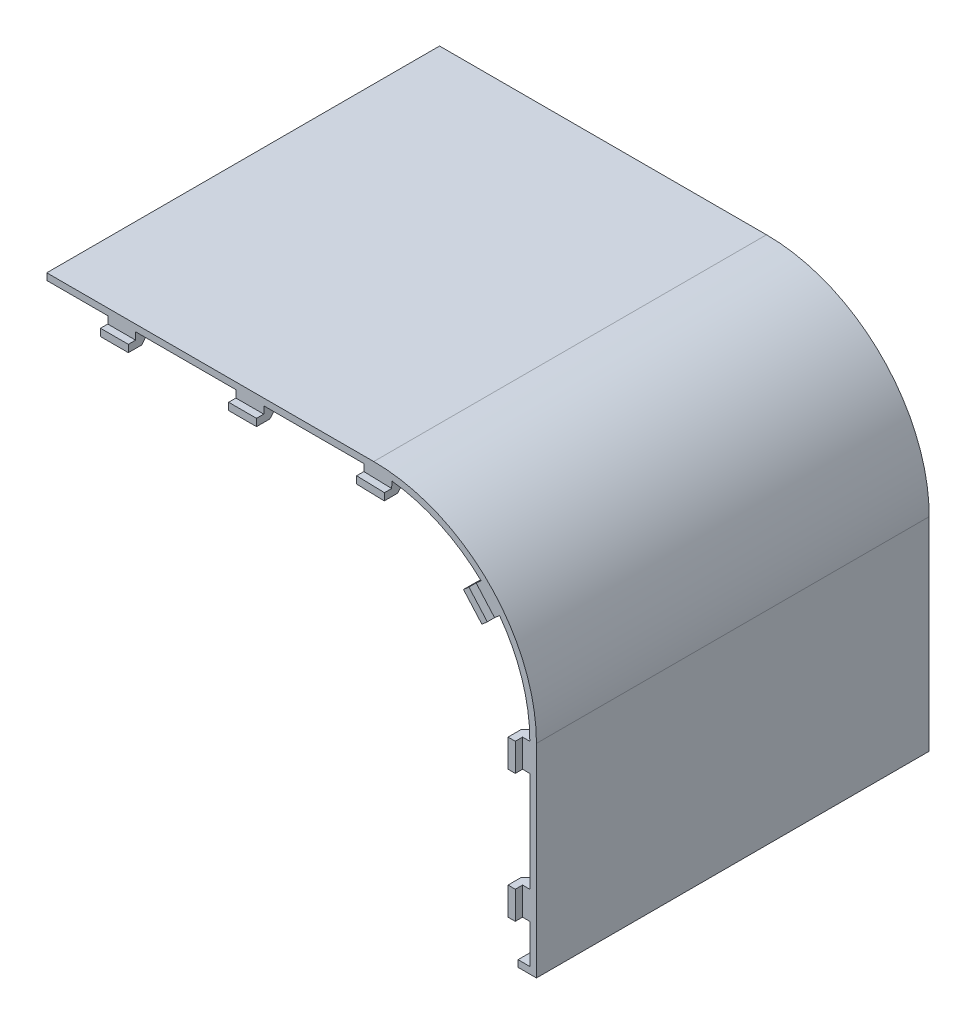
from build123d import *

# Parameters (mm, degrees)
EXTRUDE_START           = 0.1
EXTRUDE_1_DEPTH         = 70.5
SKETCH_2_W              = 5.622893455
SKETCH_2_H              = 15.568085914
CUT_EXTRUDE_1_DEPTH     = 3.9
EXTRUDE_START_2         = 7
EXTRUDE_2_DEPTH         = 5
PATTERN_START           = 11.046937644
PATTERN_CURVE_4_DEPTH   = 5
PATTERN_START_2         = 34.046937644
PATTERN_CURVE_4_2_DEPTH = 5
PATTERN_START_3         = 55.811216895
PATTERN_CURVE_4_3_DEPTH = 5
PATTERN_START_4         = 23.901307005
PATTERN_CURVE_4_4_DEPTH = 5
PATTERN_START_5         = 11.347780174
PATTERN_CURVE_4_5_DEPTH = 5


# Read off the part's stored shape, not the designer's step: Кривая4
with BuildPart() as part:
    # Эскиз1 → Бобышка-Вытянуть1 (new body)
    with BuildSketch(Plane.XY.offset(EXTRUDE_START)):
        with BuildLine():
            Line((87.992424037, 16.615738698), (87.992424037, -19.852219826))
            Line((87.992424037, -19.852219826), (86.792424037, -19.852219826))
            Line((86.792424037, -19.852219826), (84.692424037, -19.852219826))
            Line((84.692424037, -19.852219826), (84.692424037, -18.652219826))
            Line((84.692424037, -18.652219826), (86.792424037, -18.652219826))
            Line((86.792424037, -18.652219826), (86.792424037, 16.615738698))
            ThreePointArc((86.792424037, 16.615738698), (78.589229033, 36.420003331), (58.7849644, 44.623198335))
            Line((58.7849644, 44.623198335), (0.1, 44.623198335))
            Line((0.1, 44.623198335), (0.1, 45.823198335))
            Line((0.1, 45.823198335), (58.7849644, 45.823198335))
            ThreePointArc((58.7849644, 45.823198335), (79.43775717, 37.268531468), (87.992424037, 16.615738698))
        make_face()
    extrude(amount=EXTRUDE_1_DEPTH)

    # Эскиз2 → Вырез-Вытянуть1 (cut)
    with BuildSketch(Plane(origin=(0, -18.652219826, 0), x_dir=(1, 0, 0), z_dir=(0, 1, 0))):
        with Locations((83.98097731, -7.784042957)):
            Rectangle(SKETCH_2_W, SKETCH_2_H)
    extrude(amount=-CUT_EXTRUDE_1_DEPTH, mode=Mode.SUBTRACT)


with BuildPart() as body_2:
    # Эскиз4 → Бобышка-Вытянуть2 (new body)
    with BuildSketch(Plane(origin=(0, -18.652219826, 0), x_dir=(1, 0, 0), z_dir=(0, 1, 0)).offset(EXTRUDE_START_2)):
        Polygon((86.792424037, -0.1), (85.492424037, -0.1), (85.492424037, 1.2), (84.192424037, 1.2), (84.192424037, -1.2), (86.792424037, -3.381659041), align=None)
    extrude(amount=EXTRUDE_2_DEPTH)


with BuildPart() as body_3:
    # Кривая4 outline → Кривая4 (new body)
    with BuildSketch(Plane.YZ.offset(PATTERN_START)):
        Polygon((44.623198335, 0.1), (44.623198335, 3.381659041), (42.023198335, 1.2), (42.023198335, -1.2), (43.323198335, -1.2), (43.323198335, 0.1), align=None)
    extrude(amount=PATTERN_CURVE_4_DEPTH)


with BuildPart() as body_4:
    # Pattern Curve 4 2 outline → Pattern Curve 4 2 (new body)
    with BuildSketch(Plane.YZ.offset(PATTERN_START_2)):
        Polygon((44.623198335, 0.1), (44.623198335, 3.381659041), (42.023198335, 1.2), (42.023198335, -1.2), (43.323198335, -1.2), (43.323198335, 0.1), align=None)
    extrude(amount=PATTERN_CURVE_4_2_DEPTH)


with BuildPart() as body_5:
    # Pattern Curve 4 3 outline → Pattern Curve 4 3 (new body)
    with BuildSketch(Plane(origin=(0, 0, 0), x_dir=(0.0272027259746655, 0.999629937376601, 0), z_dir=(0.999629937376601, -0.0272027259746655, 0)).offset(PATTERN_START_3)):
        Polygon((44.916160749, 0.1), (46.216160749, 0.1), (46.216160749, 3.381659041), (43.616160749, 1.2), (43.616160749, -1.2), (44.916160749, -1.2), align=None)
    extrude(amount=PATTERN_CURVE_4_3_DEPTH)


with BuildPart() as body_6:
    # Pattern Curve 4 4 outline → Pattern Curve 4 4 (new body)
    with BuildSketch(Plane(origin=(0, 0, 0), x_dir=(0.7502339640677542, 0.6611724428310543, 0), z_dir=(0.6611724428310543, -0.7502339640677542, 0)).offset(PATTERN_START_4)):
        Polygon((81.79580505, 0.1), (83.09580505, 0.1), (83.09580505, 3.381659041), (80.49580505, 1.2), (80.49580505, -1.2), (81.79580505, -1.2), align=None)
    extrude(amount=PATTERN_CURVE_4_4_DEPTH)


with BuildPart() as body_7:
    # Pattern Curve 4 5 outline → Pattern Curve 4 5 (new body)
    with BuildSketch(Plane(origin=(0, 0, 0), x_dir=(1, 0, 0), z_dir=(0, 1, 0)).offset(PATTERN_START_5)):
        Polygon((86.792424037, -0.1), (85.492424037, -0.1), (85.492424037, 1.2), (84.192424037, 1.2), (84.192424037, -1.2), (86.792424037, -3.381659041), align=None)
    extrude(amount=PATTERN_CURVE_4_5_DEPTH)


with BuildPart() as body_8:
    # Зеркальное отражение3: mirrored copy
    add(body_3.part.mirror(Plane.XY.offset(35.35)))


with BuildPart() as body_9:
    # Mirror 3 2: mirrored copy
    add(body_4.part.mirror(Plane.XY.offset(35.35)))


with BuildPart() as body_10:
    # Mirror 3 3: mirrored copy
    add(body_5.part.mirror(Plane.XY.offset(35.35)))


with BuildPart() as body_11:
    # Mirror 3 4: mirrored copy
    add(body_6.part.mirror(Plane.XY.offset(35.35)))


with BuildPart() as body_12:
    # Mirror 3 5: mirrored copy
    add(body_7.part.mirror(Plane.XY.offset(35.35)))


with BuildPart() as body_13:
    # Mirror 3 6: mirrored copy
    add(body_2.part.mirror(Plane.XY.offset(35.35)))


with BuildPart() as part_1:
    add(part.part)

    # Combine 1: union body 2, body 7, body 6, body 5, body 4, body 3, body 8, body 9, body 10, body 11, body 12, body 13
    add(body_2.part)
    add(body_7.part)
    add(body_6.part)
    add(body_5.part)
    add(body_4.part)
    add(body_3.part)
    add(body_8.part)
    add(body_9.part)
    add(body_10.part)
    add(body_11.part)
    add(body_12.part)
    add(body_13.part)


solid = part_1.part
